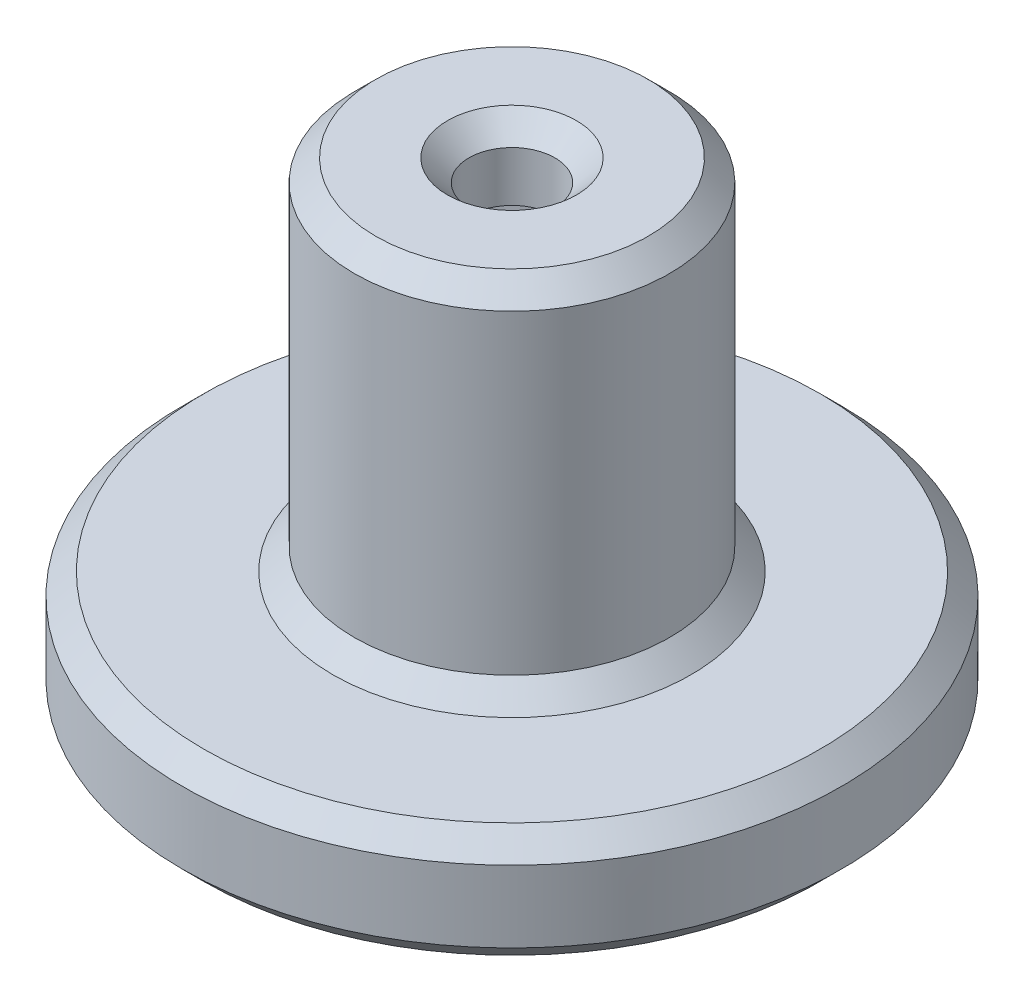
from build123d import *

# Parameters (mm, degrees)
SKETCH1_R           = 23
SKETCH1_R_2         = 11
BOSS_EXTRUDE1_DEPTH = 8
CUT_EXTRUDE1_DEPTH  = 3.5
BOSS_EXTRUDE2_START = 8
BOSS_EXTRUDE2_DEPTH = 20
BOSS_EXTRUDE3_START = 28
BOSS_EXTRUDE3_DEPTH = 5
CHAMFER1_SIZE       = 1.5


with BuildPart() as part:
    # Sketch1 → Boss-Extrude1 (new body)
    # profile 1 of 7: a face of its own
    with BuildSketch(Plane(origin=(0, 0, 0), x_dir=(1, 0, 0), z_dir=(0, 1, 0))):
        with Locations(Location((0, -3.95, 0), (0, 0, 270))):
            Circle(SKETCH1_R)
        with Locations((0, -3.95)):
            Circle(SKETCH1_R_2, mode=Mode.SUBTRACT)
    # profile 2 of 7: a face of its own
    with BuildSketch(Plane(origin=(0, 0, 0), x_dir=(1, 0, 0), z_dir=(0, 1, 0))):
        with Locations((0, -3.95)):
            Circle(SKETCH1_R_2)
        Polygon((0, -10.474058042), (5.65, -7.212029021), (5.65, -0.687970979), (0, 2.574058042), (-5.65, -0.687970979), (-5.65, -7.212029021), align=None, mode=Mode.SUBTRACT)
    # profile 3 of 7: a face of its own
    with BuildSketch(Plane(origin=(0, 0, 0), x_dir=(1, 0, 0), z_dir=(0, 1, 0))):
        with BuildLine():
            Line((5.65, -5.2), (5.65, -7.212029021))
            Line((5.65, -7.212029021), (0, -10.474058042))
            Line((0, -10.474058042), (-5.65, -7.212029021))
            Line((-5.65, -7.212029021), (-5.65, -5.2))
            Line((-5.65, -5.2), (-10.928746497, -5.2))
            ThreePointArc((-10.928746497, -5.2), (0, -14.95), (10.928746497, -5.2))
            Line((10.928746497, -5.2), (5.65, -5.2))
        make_face()
    # profile 4 of 7: a face of its own
    with BuildSketch(Plane(origin=(0, 0, 0), x_dir=(1, 0, 0), z_dir=(0, 1, 0))):
        with BuildLine():
            Line((-17.5, -5.2), (-10.928746497, -5.2))
            ThreePointArc((-10.928746497, -5.2), (-11, -3.95), (-10.928746497, -2.7))
            Line((-10.928746497, -2.7), (-17.5, -2.7))
            Line((-17.5, -2.7), (-17.5, -5.2))
        make_face()
    # profile 5 of 7: a face of its own
    with BuildSketch(Plane(origin=(0, 0, 0), x_dir=(1, 0, 0), z_dir=(0, 1, 0))):
        with BuildLine():
            ThreePointArc((11, -3.95), (10.982172177, -4.576014589), (10.928746497, -5.2))
            Line((10.928746497, -5.2), (17.5, -5.2))
            Line((17.5, -5.2), (17.5, -2.7))
            Line((17.5, -2.7), (10.928746497, -2.7))
            ThreePointArc((10.928746497, -2.7), (10.982172177, -3.323985411), (11, -3.95))
        make_face()
    # profile 6 of 7: a face of its own
    with BuildSketch(Plane(origin=(0, 0, 0), x_dir=(1, 0, 0), z_dir=(0, 1, 0))):
        with BuildLine():
            Line((5.65, -2.7), (5.65, -5.2))
            Line((5.65, -5.2), (10.928746497, -5.2))
            ThreePointArc((10.928746497, -5.2), (10.982172177, -4.576014589), (11, -3.95))
            ThreePointArc((11, -3.95), (10.982172177, -3.323985411), (10.928746497, -2.7))
            Line((10.928746497, -2.7), (5.65, -2.7))
        make_face()
    # profile 7 of 7: a face of its own
    with BuildSketch(Plane(origin=(0, 0, 0), x_dir=(1, 0, 0), z_dir=(0, 1, 0))):
        with BuildLine():
            ThreePointArc((-10.928746497, -2.7), (-11, -3.95), (-10.928746497, -5.2))
            Line((-10.928746497, -5.2), (-5.65, -5.2))
            Line((-5.65, -5.2), (-5.65, -2.7))
            Line((-5.65, -2.7), (-10.928746497, -2.7))
        make_face()
    extrude(amount=BOSS_EXTRUDE1_DEPTH)

    # Sketch1<4> → Cut-Extrude1 (cut)
    with BuildSketch(Plane(origin=(0, 0, 0), x_dir=(1, 0, 0), z_dir=(0, 1, 0))):
        with BuildLine():
            Line((-17.5, -5.2), (-10.928746497, -5.2))
            ThreePointArc((-10.928746497, -5.2), (-11, -3.95), (-10.928746497, -2.7))
            Line((-10.928746497, -2.7), (-17.5, -2.7))
            Line((-17.5, -2.7), (-17.5, -5.2))
        make_face()
        with BuildLine():
            ThreePointArc((-10.928746497, -2.7), (-11, -3.95), (-10.928746497, -5.2))
            Line((-10.928746497, -5.2), (-5.65, -5.2))
            Line((-5.65, -5.2), (-5.65, -2.7))
            Line((-5.65, -2.7), (-10.928746497, -2.7))
        make_face()
        with BuildLine():
            Line((5.65, -2.7), (5.65, -5.2))
            Line((5.65, -5.2), (10.928746497, -5.2))
            ThreePointArc((10.928746497, -5.2), (10.982172177, -4.576014589), (11, -3.95))
            ThreePointArc((11, -3.95), (10.982172177, -3.323985411), (10.928746497, -2.7))
            Line((10.928746497, -2.7), (5.65, -2.7))
        make_face()
        with BuildLine():
            ThreePointArc((11, -3.95), (10.982172177, -4.576014589), (10.928746497, -5.2))
            Line((10.928746497, -5.2), (17.5, -5.2))
            Line((17.5, -5.2), (17.5, -2.7))
            Line((17.5, -2.7), (10.928746497, -2.7))
            ThreePointArc((10.928746497, -2.7), (10.982172177, -3.323985411), (11, -3.95))
        make_face()
    extrude(amount=CUT_EXTRUDE1_DEPTH, mode=Mode.SUBTRACT)

    # Sketch1<5> → Boss-Extrude2 (add)
    with BuildSketch(Plane(origin=(0, 0, 0), x_dir=(1, 0, 0), z_dir=(0, 1, 0)).offset(BOSS_EXTRUDE2_START)):
        with BuildLine():
            Line((5.65, -5.2), (5.65, -7.212029021))
            Line((5.65, -7.212029021), (0, -10.474058042))
            Line((0, -10.474058042), (-5.65, -7.212029021))
            Line((-5.65, -7.212029021), (-5.65, -5.2))
            Line((-5.65, -5.2), (-10.928746497, -5.2))
            ThreePointArc((-10.928746497, -5.2), (0, -14.95), (10.928746497, -5.2))
            Line((10.928746497, -5.2), (5.65, -5.2))
        make_face()
        with BuildLine():
            Line((5.65, -0.687970979), (5.65, -2.7))
            Line((5.65, -2.7), (10.928746497, -2.7))
            ThreePointArc((10.928746497, -2.7), (0, 7.05), (-10.928746497, -2.7))
            Line((-10.928746497, -2.7), (-5.65, -2.7))
            Line((-5.65, -2.7), (-5.65, -0.687970979))
            Line((-5.65, -0.687970979), (0, 2.574058042))
            Line((0, 2.574058042), (5.65, -0.687970979))
        make_face()
        with BuildLine():
            ThreePointArc((-10.928746497, -2.7), (-11, -3.95), (-10.928746497, -5.2))
            Line((-10.928746497, -5.2), (-5.65, -5.2))
            Line((-5.65, -5.2), (-5.65, -2.7))
            Line((-5.65, -2.7), (-10.928746497, -2.7))
        make_face()
        with BuildLine():
            Line((5.65, -2.7), (5.65, -5.2))
            Line((5.65, -5.2), (10.928746497, -5.2))
            ThreePointArc((10.928746497, -5.2), (10.982172177, -4.576014589), (11, -3.95))
            ThreePointArc((11, -3.95), (10.982172177, -3.323985411), (10.928746497, -2.7))
            Line((10.928746497, -2.7), (5.65, -2.7))
        make_face()
    extrude(amount=BOSS_EXTRUDE2_DEPTH)

    # Sketch1<6> → Boss-Extrude3 (add)
    with BuildSketch(Plane(origin=(0, 0, 0), x_dir=(1, 0, 0), z_dir=(0, 1, 0)).offset(BOSS_EXTRUDE3_START)):
        with BuildLine():
            Line((5.65, -5.2), (5.65, -7.212029021))
            Line((5.65, -7.212029021), (0, -10.474058042))
            Line((0, -10.474058042), (-5.65, -7.212029021))
            Line((-5.65, -7.212029021), (-5.65, -5.2))
            Line((-5.65, -5.2), (-10.928746497, -5.2))
            ThreePointArc((-10.928746497, -5.2), (0, -14.95), (10.928746497, -5.2))
            Line((10.928746497, -5.2), (5.65, -5.2))
        make_face()
        with BuildLine():
            Line((0, -10.474058042), (5.65, -7.212029021))
            Line((5.65, -7.212029021), (5.65, -5.2))
            Line((5.65, -5.2), (2.727178029, -5.2))
            ThreePointArc((2.727178029, -5.2), (0, -6.95), (-2.727178029, -5.2))
            Line((-2.727178029, -5.2), (-5.65, -5.2))
            Line((-5.65, -5.2), (-5.65, -7.212029021))
            Line((-5.65, -7.212029021), (0, -10.474058042))
        make_face()
        with BuildLine():
            Line((2.727178029, -2.7), (5.65, -2.7))
            Line((5.65, -2.7), (5.65, -0.687970979))
            Line((5.65, -0.687970979), (0, 2.574058042))
            Line((0, 2.574058042), (-5.65, -0.687970979))
            Line((-5.65, -0.687970979), (-5.65, -2.7))
            Line((-5.65, -2.7), (-2.727178029, -2.7))
            ThreePointArc((-2.727178029, -2.7), (0, -0.95), (2.727178029, -2.7))
        make_face()
        with BuildLine():
            Line((5.65, -0.687970979), (5.65, -2.7))
            Line((5.65, -2.7), (10.928746497, -2.7))
            ThreePointArc((10.928746497, -2.7), (0, 7.05), (-10.928746497, -2.7))
            Line((-10.928746497, -2.7), (-5.65, -2.7))
            Line((-5.65, -2.7), (-5.65, -0.687970979))
            Line((-5.65, -0.687970979), (0, 2.574058042))
            Line((0, 2.574058042), (5.65, -0.687970979))
        make_face()
        with BuildLine():
            Line((5.65, -2.7), (5.65, -5.2))
            Line((5.65, -5.2), (10.928746497, -5.2))
            ThreePointArc((10.928746497, -5.2), (10.982172177, -4.576014589), (11, -3.95))
            ThreePointArc((11, -3.95), (10.982172177, -3.323985411), (10.928746497, -2.7))
            Line((10.928746497, -2.7), (5.65, -2.7))
        make_face()
        with BuildLine():
            ThreePointArc((-10.928746497, -2.7), (-11, -3.95), (-10.928746497, -5.2))
            Line((-10.928746497, -5.2), (-5.65, -5.2))
            Line((-5.65, -5.2), (-5.65, -2.7))
            Line((-5.65, -2.7), (-10.928746497, -2.7))
        make_face()
        with BuildLine():
            Line((2.727178029, -5.2), (5.65, -5.2))
            Line((5.65, -5.2), (5.65, -2.7))
            Line((5.65, -2.7), (2.727178029, -2.7))
            ThreePointArc((2.727178029, -2.7), (2.931001031, -3.310286817), (3, -3.95))
            ThreePointArc((3, -3.95), (2.931001031, -4.589713183), (2.727178029, -5.2))
        make_face()
        with BuildLine():
            Line((-5.65, -5.2), (-2.727178029, -5.2))
            ThreePointArc((-2.727178029, -5.2), (-3, -3.95), (-2.727178029, -2.7))
            Line((-2.727178029, -2.7), (-5.65, -2.7))
            Line((-5.65, -2.7), (-5.65, -5.2))
        make_face()
    extrude(amount=BOSS_EXTRUDE3_DEPTH)

    # Chamfer1
    # the kernel refuses this chamfer: 1.5 mm, written as the material it adds along each edge
    with BuildSketch(Plane(origin=(0, 8, 3.95), x_dir=(0.9935224088361082, 0, 0.11363636363636874), z_dir=(-0.11363636363636874, 0, 0.9935224088361082))) as chamfer1_piece_1:
        Polygon((11 + CHAMFER1_SIZE, 0), (11, CHAMFER1_SIZE), (11, 0), align=None)
    revolve(axis=Axis((0, 8, 3.95), (0, 1, 0)))
    # the kernel refuses this chamfer: 1.5 mm, written as the material it takes off along each edge
    with BuildSketch(Plane(origin=(-8.990714197, 0, 5.28326678), x_dir=(-0.4998109584556484, -0.027495876610586358, 0.8656979742248804), z_dir=(0.8660254037844387, 0, 0.49999999999999994))) as chamfer1_2_piece_1_section:
        Polygon((CHAMFER1_SIZE * 0.999621916911, -CHAMFER1_SIZE * 0.0274958766106), (-CHAMFER1_SIZE * 0.0274958766106, -CHAMFER1_SIZE * 0.999621916911), (0, 0), align=None)
    chamfer1_2_piece_1 = extrude(amount=14.239107006, mode=Mode.PRIVATE)
    chamfer1_2_piece_1 = split(chamfer1_2_piece_1, bisect_by=Plane(origin=(-5.65, 0.509507135, 9.247455904), z_dir=(1, 0, 0)), keep=Keep.TOP, mode=Mode.PRIVATE)
    chamfer1_2_piece_1 = split(chamfer1_2_piece_1, bisect_by=Plane(origin=(-1.762731388, 0.509507135, 11.491771483), z_dir=(-0.5000000000000003, 0, -0.8660254037844385)), keep=Keep.TOP, mode=Mode.PRIVATE)
    add(chamfer1_2_piece_1, mode=Mode.SUBTRACT)
    with BuildSketch(Plane(origin=(-3.340714197, 0, 12.402820283), x_dir=(0.49981095845564866, -0.02749587661058636, 0.86569797422488), z_dir=(0.8660254037844385, 0, -0.5000000000000003))) as chamfer1_2_piece_2_section:
        Polygon((CHAMFER1_SIZE * 0.999621916911, -CHAMFER1_SIZE * 0.0274958766106), (-CHAMFER1_SIZE * 0.0274958766106, -CHAMFER1_SIZE * 0.999621916911), (0, 0), align=None)
    chamfer1_2_piece_2 = extrude(amount=14.239107006, mode=Mode.PRIVATE)
    chamfer1_2_piece_2 = split(chamfer1_2_piece_2, bisect_by=Plane(origin=(5.65, 0.509507135, 9.247455904), z_dir=(-1, 0, 0)), keep=Keep.TOP, mode=Mode.PRIVATE)
    chamfer1_2_piece_2 = split(chamfer1_2_piece_2, bisect_by=Plane(origin=(1.762731388, 0.509507135, 11.491771483), z_dir=(0.49999999999999994, 0, -0.8660254037844387)), keep=Keep.TOP, mode=Mode.PRIVATE)
    add(chamfer1_2_piece_2, mode=Mode.SUBTRACT)
    with BuildSketch(Plane(origin=(5.65, 0, 11.069553503), x_dir=(0.9996219169112969, -0.027495876610586382, 0), z_dir=(0, 0, -1))) as chamfer1_2_piece_3_section:
        Polygon((CHAMFER1_SIZE * 0.999621916911, -CHAMFER1_SIZE * 0.0274958766106), (-CHAMFER1_SIZE * 0.0274958766106, -CHAMFER1_SIZE * 0.999621916911), (0, 0), align=None)
    chamfer1_2_piece_3 = extrude(amount=9.727077985, mode=Mode.PRIVATE)
    chamfer1_2_piece_3 = split(chamfer1_2_piece_3, bisect_by=Plane(origin=(7.340723273, 0.502588209, 6.235889484), z_dir=(-0.5000000000000003, 0, -0.8660254037844385)), keep=Keep.TOP, mode=Mode.PRIVATE)
    add(chamfer1_2_piece_3, mode=Mode.SUBTRACT)
    with BuildSketch(Plane(origin=(8.990714197, 0, 2.61673322), x_dir=(0.49981095845564816, -0.027495876610586365, -0.8656979742248805), z_dir=(-0.8660254037844388, 0, -0.4999999999999998))) as chamfer1_2_piece_4_section:
        Polygon((CHAMFER1_SIZE * 0.999621916911, -CHAMFER1_SIZE * 0.0274958766106), (-CHAMFER1_SIZE * 0.0274958766106, -CHAMFER1_SIZE * 0.999621916911), (0, 0), align=None)
    chamfer1_2_piece_4 = extrude(amount=14.239107006, mode=Mode.PRIVATE)
    chamfer1_2_piece_4 = split(chamfer1_2_piece_4, bisect_by=Plane(origin=(5.65, 0.509507135, -1.347455904), z_dir=(-1, 0, 0)), keep=Keep.TOP, mode=Mode.PRIVATE)
    chamfer1_2_piece_4 = split(chamfer1_2_piece_4, bisect_by=Plane(origin=(1.762731388, 0.509507135, -3.591771483), z_dir=(0.5000000000000001, 0, 0.8660254037844386)), keep=Keep.TOP, mode=Mode.PRIVATE)
    add(chamfer1_2_piece_4, mode=Mode.SUBTRACT)
    with BuildSketch(Plane(origin=(-5.65, 0, 1.342475518), x_dir=(-0.9996219169112969, -0.027495876610586382, 0), z_dir=(0, 0, 1))) as chamfer1_2_piece_5_section:
        Polygon((CHAMFER1_SIZE * 0.999621916911, -CHAMFER1_SIZE * 0.0274958766106), (-CHAMFER1_SIZE * 0.0274958766106, -CHAMFER1_SIZE * 0.999621916911), (0, 0), align=None)
    chamfer1_2_piece_5 = extrude(amount=9.727077985, mode=Mode.PRIVATE)
    chamfer1_2_piece_5 = split(chamfer1_2_piece_5, bisect_by=Plane(origin=(-7.340723273, 0.502588209, 6.235889484), z_dir=(0.49999999999999994, 0, -0.8660254037844387)), keep=Keep.TOP, mode=Mode.PRIVATE)
    add(chamfer1_2_piece_5, mode=Mode.SUBTRACT)
    with BuildSketch(Plane(origin=(5.65, 0, 6.557524482), x_dir=(0.9996219169112969, -0.027495876610586382, 0), z_dir=(0, 0, -1))) as chamfer1_2_piece_6_section:
        Polygon((CHAMFER1_SIZE * 0.999621916911, -CHAMFER1_SIZE * 0.0274958766106), (-CHAMFER1_SIZE * 0.0274958766106, -CHAMFER1_SIZE * 0.999621916911), (0, 0), align=None)
    chamfer1_2_piece_6 = extrude(amount=9.727077985, mode=Mode.PRIVATE)
    chamfer1_2_piece_6 = split(chamfer1_2_piece_6, bisect_by=Plane(origin=(7.340723273, 0.502588209, 1.664110516), z_dir=(-0.4999999999999998, 0, 0.8660254037844388)), keep=Keep.TOP, mode=Mode.PRIVATE)
    add(chamfer1_2_piece_6, mode=Mode.SUBTRACT)
    with BuildSketch(Plane(origin=(0, 8, 3.95), x_dir=(0, 0, 1), z_dir=(-1, 0, 0))) as chamfer1_2_piece_7:
        Polygon((23, -CHAMFER1_SIZE), (23 - CHAMFER1_SIZE, 0), (23, 0), align=None)
    revolve(axis=Axis((0, 8, 3.95), (0, 1, 0)), mode=Mode.SUBTRACT)
    with BuildSketch(Plane(origin=(0, 33, 3.95), x_dir=(-0.9935224088361069, 0, -0.1136363636363809), z_dir=(0.1136363636363809, 0, -0.9935224088361069))) as chamfer1_2_piece_8:
        Polygon((11, -CHAMFER1_SIZE), (11 - CHAMFER1_SIZE, 0), (11, 0), align=None)
    revolve(axis=Axis((0, 33, 3.95), (0, 1, 0)), mode=Mode.SUBTRACT)
    with BuildSketch(Plane(origin=(0, 33, 3.95), x_dir=(0.9090593428863087, 0, 0.4166666666666683), z_dir=(-0.4166666666666683, 0, 0.9090593428863087))) as chamfer1_2_piece_9:
        Polygon((3, -CHAMFER1_SIZE), (3 + CHAMFER1_SIZE, 0), (3, 0), align=None)
    revolve(axis=Axis((0, 33, 3.95), (0, 1, 0)), mode=Mode.SUBTRACT)
    with BuildSketch(Plane(origin=(0, 0, 3.95), x_dir=(0, 0, 1), z_dir=(-1, 0, 0))) as chamfer1_2_piece_10:
        Polygon((23, CHAMFER1_SIZE), (23 - CHAMFER1_SIZE, 0), (23, 0), align=None)
    revolve(axis=Axis((0, 0, 3.95), (0, 1, 0)), mode=Mode.SUBTRACT)
    with BuildSketch(Plane(origin=(3.340714197, 0, -4.502820283), x_dir=(-0.4998109584556485, -0.027495876610586382, -0.8656979742248803), z_dir=(-0.8660254037844386, 0, 0.5000000000000001))) as chamfer1_2_piece_11_section:
        Polygon((CHAMFER1_SIZE * 0.999621916911, -CHAMFER1_SIZE * 0.0274958766106), (-CHAMFER1_SIZE * 0.0274958766106, -CHAMFER1_SIZE * 0.999621916911), (0, 0), align=None)
    chamfer1_2_piece_11 = extrude(amount=14.239107006, mode=Mode.PRIVATE)
    chamfer1_2_piece_11 = split(chamfer1_2_piece_11, bisect_by=Plane(origin=(-1.762731388, 0.509507135, -3.591771483), z_dir=(-0.4999999999999998, 0, 0.8660254037844388)), keep=Keep.TOP, mode=Mode.PRIVATE)
    chamfer1_2_piece_11 = split(chamfer1_2_piece_11, bisect_by=Plane(origin=(-5.65, 0.509507135, -1.347455904), z_dir=(1, 0, 0)), keep=Keep.TOP, mode=Mode.PRIVATE)
    add(chamfer1_2_piece_11, mode=Mode.SUBTRACT)
    with BuildSketch(Plane(origin=(-5.65, 0, -3.169553503), x_dir=(-0.9996219169112969, -0.027495876610586382, 0), z_dir=(0, 0, 1))) as chamfer1_2_piece_12_section:
        Polygon((CHAMFER1_SIZE * 0.999621916911, -CHAMFER1_SIZE * 0.0274958766106), (-CHAMFER1_SIZE * 0.0274958766106, -CHAMFER1_SIZE * 0.999621916911), (0, 0), align=None)
    chamfer1_2_piece_12 = extrude(amount=9.727077985, mode=Mode.PRIVATE)
    chamfer1_2_piece_12 = split(chamfer1_2_piece_12, bisect_by=Plane(origin=(-7.340723273, 0.502588209, 1.664110516), z_dir=(0.5000000000000001, 0, 0.8660254037844386)), keep=Keep.TOP, mode=Mode.PRIVATE)
    add(chamfer1_2_piece_12, mode=Mode.SUBTRACT)
    with BuildSketch(Plane(origin=(-5.65, 0, 1.342475518), x_dir=(-0.9996219169112969, -0.027495876610586382, 0), z_dir=(0, 0, 1))) as chamfer1_2_piece_13a_section:
        Polygon((CHAMFER1_SIZE * 0.999621916911, -CHAMFER1_SIZE * 0.0274958766106), (-CHAMFER1_SIZE * 0.0274958766106, -CHAMFER1_SIZE * 0.999621916911), (0, 0), align=None)
    chamfer1_2_piece_13a = extrude(amount=9.727077985, mode=Mode.PRIVATE)
    chamfer1_2_piece_13a = split(chamfer1_2_piece_13a, bisect_by=Plane(origin=(-5.265097348, 0.484046156, 7.434252671), z_dir=(-0.49999999999999994, 0, 0.8660254037844387)), keep=Keep.TOP, mode=Mode.PRIVATE)
    with BuildSketch(Plane(origin=(-8.990714197, 0, 5.28326678), x_dir=(-0.4998109584556484, -0.027495876610586358, 0.8656979742248804), z_dir=(0.8660254037844387, 0, 0.49999999999999994))) as chamfer1_2_piece_13b_section:
        Polygon((CHAMFER1_SIZE * 0.999621916911, -CHAMFER1_SIZE * 0.0274958766106), (-CHAMFER1_SIZE * 0.0274958766106, -CHAMFER1_SIZE * 0.999621916911), (0, 0), align=None)
    chamfer1_2_piece_13b = extrude(amount=14.239107006, mode=Mode.PRIVATE)
    chamfer1_2_piece_13b = split(chamfer1_2_piece_13b, bisect_by=Plane(origin=(-5.65, 0.484046156, 6.767581721), z_dir=(-1, 0, 0)), keep=Keep.TOP, mode=Mode.PRIVATE)
    chamfer1_2_piece_13 = chamfer1_2_piece_13a & chamfer1_2_piece_13b
    add(chamfer1_2_piece_13, mode=Mode.SUBTRACT)
    with BuildSketch(Plane(origin=(-8.990714197, 0, 5.28326678), x_dir=(-0.4998109584556484, -0.027495876610586358, 0.8656979742248804), z_dir=(0.8660254037844387, 0, 0.49999999999999994))) as chamfer1_2_piece_14a_section:
        Polygon((CHAMFER1_SIZE * 0.999621916911, -CHAMFER1_SIZE * 0.0274958766106), (-CHAMFER1_SIZE * 0.0274958766106, -CHAMFER1_SIZE * 0.999621916911), (0, 0), align=None)
    chamfer1_2_piece_14a = extrude(amount=14.239107006, mode=Mode.PRIVATE)
    chamfer1_2_piece_14a = split(chamfer1_2_piece_14a, bisect_by=Plane(origin=(0.384902652, 0.484046156, 10.251834392), z_dir=(0.5000000000000003, 0, 0.8660254037844385)), keep=Keep.TOP, mode=Mode.PRIVATE)
    with BuildSketch(Plane(origin=(-3.340714197, 0, 12.402820283), x_dir=(0.49981095845564866, -0.02749587661058636, 0.86569797422488), z_dir=(0.8660254037844385, 0, -0.5000000000000003))) as chamfer1_2_piece_14b_section:
        Polygon((CHAMFER1_SIZE * 0.999621916911, -CHAMFER1_SIZE * 0.0274958766106), (-CHAMFER1_SIZE * 0.0274958766106, -CHAMFER1_SIZE * 0.999621916911), (0, 0), align=None)
    chamfer1_2_piece_14b = extrude(amount=14.239107006, mode=Mode.PRIVATE)
    chamfer1_2_piece_14b = split(chamfer1_2_piece_14b, bisect_by=Plane(origin=(-0.384902652, 0.484046156, 10.251834392), z_dir=(-0.49999999999999994, 0, 0.8660254037844387)), keep=Keep.TOP, mode=Mode.PRIVATE)
    chamfer1_2_piece_14 = chamfer1_2_piece_14a & chamfer1_2_piece_14b
    add(chamfer1_2_piece_14, mode=Mode.SUBTRACT)
    with BuildSketch(Plane(origin=(5.65, 0, 11.069553503), x_dir=(0.9996219169112969, -0.027495876610586382, 0), z_dir=(0, 0, -1))) as chamfer1_2_piece_15a_section:
        Polygon((CHAMFER1_SIZE * 0.999621916911, -CHAMFER1_SIZE * 0.0274958766106), (-CHAMFER1_SIZE * 0.0274958766106, -CHAMFER1_SIZE * 0.999621916911), (0, 0), align=None)
    chamfer1_2_piece_15a = extrude(amount=9.727077985, mode=Mode.PRIVATE)
    chamfer1_2_piece_15a = split(chamfer1_2_piece_15a, bisect_by=Plane(origin=(5.265097348, 0.484046156, 7.434252671), z_dir=(0.5000000000000003, 0, 0.8660254037844385)), keep=Keep.TOP, mode=Mode.PRIVATE)
    with BuildSketch(Plane(origin=(-3.340714197, 0, 12.402820283), x_dir=(0.49981095845564866, -0.02749587661058636, 0.86569797422488), z_dir=(0.8660254037844385, 0, -0.5000000000000003))) as chamfer1_2_piece_15b_section:
        Polygon((CHAMFER1_SIZE * 0.999621916911, -CHAMFER1_SIZE * 0.0274958766106), (-CHAMFER1_SIZE * 0.0274958766106, -CHAMFER1_SIZE * 0.999621916911), (0, 0), align=None)
    chamfer1_2_piece_15b = extrude(amount=14.239107006, mode=Mode.PRIVATE)
    chamfer1_2_piece_15b = split(chamfer1_2_piece_15b, bisect_by=Plane(origin=(5.65, 0.484046156, 6.767581721), z_dir=(1, 0, 0)), keep=Keep.TOP, mode=Mode.PRIVATE)
    chamfer1_2_piece_15 = chamfer1_2_piece_15a & chamfer1_2_piece_15b
    add(chamfer1_2_piece_15, mode=Mode.SUBTRACT)
    with BuildSketch(Plane(origin=(5.65, 0, 6.557524482), x_dir=(0.9996219169112969, -0.027495876610586382, 0), z_dir=(0, 0, -1))) as chamfer1_2_piece_16a_section:
        Polygon((CHAMFER1_SIZE * 0.999621916911, -CHAMFER1_SIZE * 0.0274958766106), (-CHAMFER1_SIZE * 0.0274958766106, -CHAMFER1_SIZE * 0.999621916911), (0, 0), align=None)
    chamfer1_2_piece_16a = extrude(amount=9.727077985, mode=Mode.PRIVATE)
    chamfer1_2_piece_16a = split(chamfer1_2_piece_16a, bisect_by=Plane(origin=(5.265097348, 0.484046156, 0.465747329), z_dir=(0.4999999999999998, 0, -0.8660254037844388)), keep=Keep.TOP, mode=Mode.PRIVATE)
    with BuildSketch(Plane(origin=(8.990714197, 0, 2.61673322), x_dir=(0.49981095845564816, -0.027495876610586365, -0.8656979742248805), z_dir=(-0.8660254037844388, 0, -0.4999999999999998))) as chamfer1_2_piece_16b_section:
        Polygon((CHAMFER1_SIZE * 0.999621916911, -CHAMFER1_SIZE * 0.0274958766106), (-CHAMFER1_SIZE * 0.0274958766106, -CHAMFER1_SIZE * 0.999621916911), (0, 0), align=None)
    chamfer1_2_piece_16b = extrude(amount=14.239107006, mode=Mode.PRIVATE)
    chamfer1_2_piece_16b = split(chamfer1_2_piece_16b, bisect_by=Plane(origin=(5.65, 0.484046156, 1.132418279), z_dir=(1, 0, 0)), keep=Keep.TOP, mode=Mode.PRIVATE)
    chamfer1_2_piece_16 = chamfer1_2_piece_16a & chamfer1_2_piece_16b
    add(chamfer1_2_piece_16, mode=Mode.SUBTRACT)
    with BuildSketch(Plane(origin=(8.990714197, 0, 2.61673322), x_dir=(0.49981095845564816, -0.027495876610586365, -0.8656979742248805), z_dir=(-0.8660254037844388, 0, -0.4999999999999998))) as chamfer1_2_piece_17a_section:
        Polygon((CHAMFER1_SIZE * 0.999621916911, -CHAMFER1_SIZE * 0.0274958766106), (-CHAMFER1_SIZE * 0.0274958766106, -CHAMFER1_SIZE * 0.999621916911), (0, 0), align=None)
    chamfer1_2_piece_17a = extrude(amount=14.239107006, mode=Mode.PRIVATE)
    chamfer1_2_piece_17a = split(chamfer1_2_piece_17a, bisect_by=Plane(origin=(-0.384902652, 0.484046156, -2.351834392), z_dir=(-0.5000000000000001, 0, -0.8660254037844386)), keep=Keep.TOP, mode=Mode.PRIVATE)
    with BuildSketch(Plane(origin=(3.340714197, 0, -4.502820283), x_dir=(-0.4998109584556485, -0.027495876610586382, -0.8656979742248803), z_dir=(-0.8660254037844386, 0, 0.5000000000000001))) as chamfer1_2_piece_17b_section:
        Polygon((CHAMFER1_SIZE * 0.999621916911, -CHAMFER1_SIZE * 0.0274958766106), (-CHAMFER1_SIZE * 0.0274958766106, -CHAMFER1_SIZE * 0.999621916911), (0, 0), align=None)
    chamfer1_2_piece_17b = extrude(amount=14.239107006, mode=Mode.PRIVATE)
    chamfer1_2_piece_17b = split(chamfer1_2_piece_17b, bisect_by=Plane(origin=(0.384902652, 0.484046156, -2.351834392), z_dir=(0.4999999999999998, 0, -0.8660254037844388)), keep=Keep.TOP, mode=Mode.PRIVATE)
    chamfer1_2_piece_17 = chamfer1_2_piece_17a & chamfer1_2_piece_17b
    add(chamfer1_2_piece_17, mode=Mode.SUBTRACT)
    with BuildSketch(Plane(origin=(3.340714197, 0, -4.502820283), x_dir=(-0.4998109584556485, -0.027495876610586382, -0.8656979742248803), z_dir=(-0.8660254037844386, 0, 0.5000000000000001))) as chamfer1_2_piece_18a_section:
        Polygon((CHAMFER1_SIZE * 0.999621916911, -CHAMFER1_SIZE * 0.0274958766106), (-CHAMFER1_SIZE * 0.0274958766106, -CHAMFER1_SIZE * 0.999621916911), (0, 0), align=None)
    chamfer1_2_piece_18a = extrude(amount=14.239107006, mode=Mode.PRIVATE)
    chamfer1_2_piece_18a = split(chamfer1_2_piece_18a, bisect_by=Plane(origin=(-5.65, 0.484046156, 1.132418279), z_dir=(-1, 0, 0)), keep=Keep.TOP, mode=Mode.PRIVATE)
    with BuildSketch(Plane(origin=(-5.65, 0, -3.169553503), x_dir=(-0.9996219169112969, -0.027495876610586382, 0), z_dir=(0, 0, 1))) as chamfer1_2_piece_18b_section:
        Polygon((CHAMFER1_SIZE * 0.999621916911, -CHAMFER1_SIZE * 0.0274958766106), (-CHAMFER1_SIZE * 0.0274958766106, -CHAMFER1_SIZE * 0.999621916911), (0, 0), align=None)
    chamfer1_2_piece_18b = extrude(amount=9.727077985, mode=Mode.PRIVATE)
    chamfer1_2_piece_18b = split(chamfer1_2_piece_18b, bisect_by=Plane(origin=(-5.265097348, 0.484046156, 0.465747329), z_dir=(-0.5000000000000001, 0, -0.8660254037844386)), keep=Keep.TOP, mode=Mode.PRIVATE)
    chamfer1_2_piece_18 = chamfer1_2_piece_18a & chamfer1_2_piece_18b
    add(chamfer1_2_piece_18, mode=Mode.SUBTRACT)


solid = part.part
